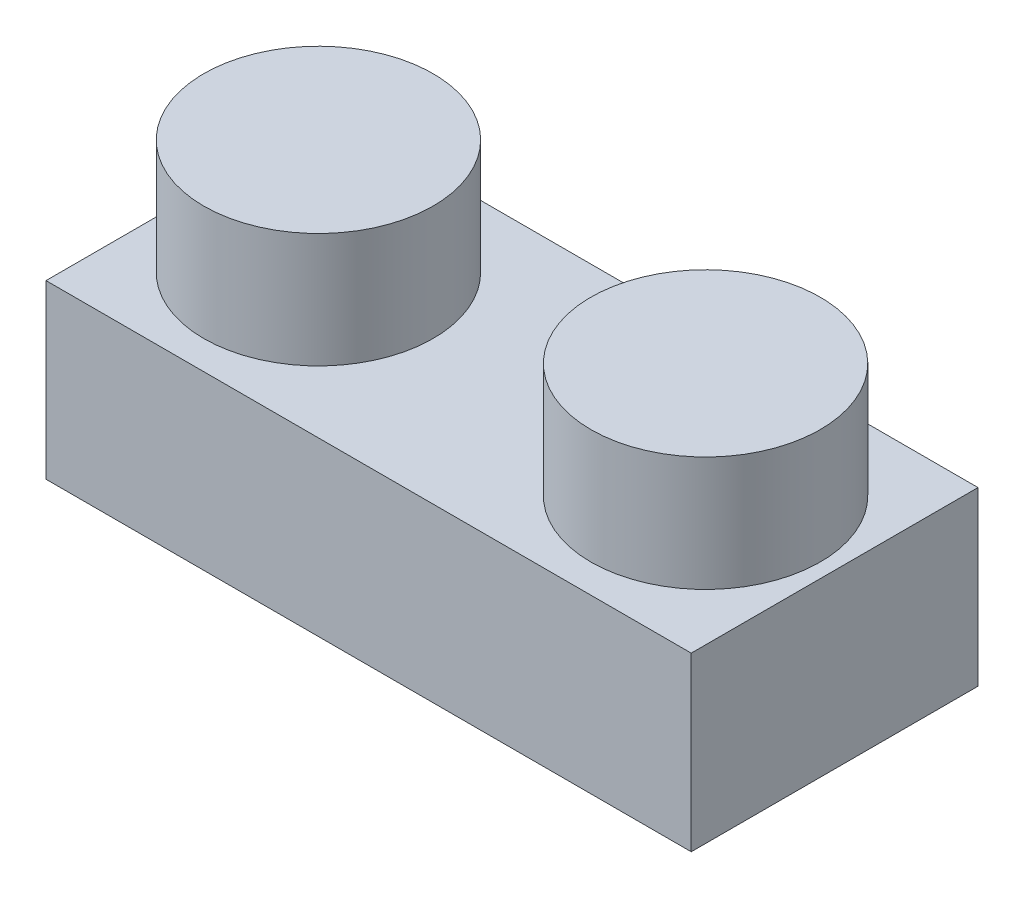
from build123d import *

# Parameters (mm, degrees)
SKETCH1_W           = 45
SKETCH1_H           = 20
BOSS_EXTRUDE1_DEPTH = 12
SKETCH2_R           = 8
BOSS_EXTRUDE2_DEPTH = 8


with BuildPart() as part:
    # Sketch1 → Boss-Extrude1 (new body)
    with BuildSketch(Plane(origin=(0, 0, 0), x_dir=(1, 0, 0), z_dir=(0, 1, 0))):
        Rectangle(SKETCH1_W, SKETCH1_H)
    extrude(amount=BOSS_EXTRUDE1_DEPTH)

    # Sketch2 → Boss-Extrude2 (add)
    with BuildSketch(Plane(origin=(0, 12, 0), x_dir=(1, 0, 0), z_dir=(0, 1, 0))):
        with Locations((-13.5, 0)):
            Circle(SKETCH2_R)
        with Locations((13.5, 0)):
            Circle(SKETCH2_R)
    extrude(amount=BOSS_EXTRUDE2_DEPTH)


solid = part.part
